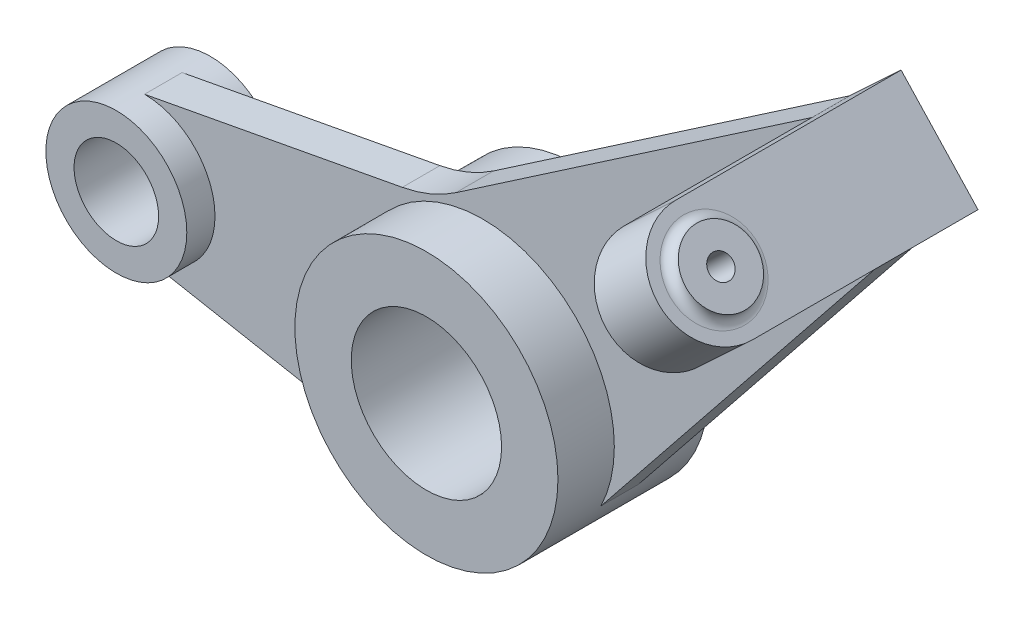
from build123d import *

# Parameters (mm, degrees)
SKETCH1_R           = 28
SKETCH1_R_2         = 16
BOSS_EXTRUDE1_DEPTH = 16
SKETCH2_R           = 15
SKETCH2_R_2         = 9
BOSS_EXTRUDE2_DEPTH = 10
BOSS_EXTRUDE3_DEPTH = 4
BOSS_EXTRUDE4_DEPTH = 4
BOSS_EXTRUDE5_DEPTH = 60
CUT_EXTRUDE1_DEPTH  = 216.77207691
HOLE1_D             = 5
HOLE1_CBORE_D       = 12
HOLE1_CBORE_DEPTH   = 6
BOSS_EXTRUDE6_START = 2
SKETCH9_R           = 7.5
SKETCH9_R_2         = 2.5
BOSS_EXTRUDE6_DEPTH = 2
FILLET1_R           = 30
FILLET2_R           = 2


with BuildPart() as part:
    # Sketch1 → Boss-Extrude1 (new, symmetric)
    with BuildSketch(Plane.XY):
        Circle(SKETCH1_R)
        Circle(SKETCH1_R_2, mode=Mode.SUBTRACT)
    extrude(amount=BOSS_EXTRUDE1_DEPTH, both=True)



with BuildPart() as body_2:
    # Sketch2 → Boss-Extrude2 (new, symmetric)
    with BuildSketch(Plane.XY):
        with Locations((-72, 0)):
            Circle(SKETCH2_R)
        with Locations((-72, 0)):
            Circle(SKETCH2_R_2, mode=Mode.SUBTRACT)
    extrude(amount=BOSS_EXTRUDE2_DEPTH, both=True)


with BuildPart() as part_1:
    add(part.part)

    add(body_2.part)  # Boss-Extrude3 merges body 2
    # Sketch3 → Boss-Extrude3 (add, symmetric)
    with BuildSketch(Plane.XY):
        with BuildLine():
            Line((-72, 15), (-5.155280446, 27.521320527))
            ThreePointArc((-5.155280446, 27.521320527), (-28, 0), (-5.155280446, -27.521320527))
            Line((-5.155280446, -27.521320527), (-72, -15))
            ThreePointArc((-72, -15), (-57, 0), (-72, 15))
        make_face()
    extrude(amount=BOSS_EXTRUDE3_DEPTH, both=True)

    # Sketch4 → Boss-Extrude4 (add, symmetric)
    with BuildSketch(Plane.XY):
        with BuildLine():
            Line((70.070865753, 81.750068946), (86.438826394, 64.197580107))
            Line((86.438826394, 64.197580107), (25.1229929, -12.362654559))
            ThreePointArc((25.1229929, -12.362654559), (22.301575109, 16.930438496), (-5.155280446, 27.521320527))
            Line((-5.155280446, 27.521320527), (-10.933902304, 26.438871876))
            Line((-10.933902304, 26.438871876), (70.070865753, 81.750068946))
        make_face()
    extrude(amount=BOSS_EXTRUDE4_DEPTH, both=True)

    # Sketch5 → Boss-Extrude5 (add)
    with BuildSketch(Plane(origin=(0, 0, -4), x_dir=(-1, 0, 0), z_dir=(0, 0, -1))):
        Polygon((-70.070865753, 81.750068946), (-81.041171277, 91.980044347), (-97.409131918, 74.427555508), (-86.438826394, 64.197580107), align=None)
    extrude(amount=-BOSS_EXTRUDE5_DEPTH)

    # Sketch6 → Cut-Extrude1 (cut, through all)
    with BuildSketch(Plane(origin=(89.225151598, 83.203799928, 0), x_dir=(0, 0, -1), z_dir=(0.7313537016191697, 0.6819983600624995, 0))):
        with BuildLine():
            Line((-56, 12), (-56, 0))
            ThreePointArc((-56, 0), (-52.485281374, 8.485281374), (-44, 12))
            Line((-44, 12), (-56, 12))
        make_face()
        with BuildLine():
            Line((-56, 0), (-56, -12))
            Line((-56, -12), (-44, -12))
            ThreePointArc((-44, -12), (-52.485281374, -8.485281374), (-56, 0))
        make_face()
    extrude(amount=-CUT_EXTRUDE1_DEPTH, mode=Mode.SUBTRACT)

    # Hole1 (through all)
    with Locations(Plane(origin=(78.254846073, 72.973824527, 0), x_dir=(0, 0, 1), z_dir=(-0.7313537016191697, -0.6819983600624995, 0))):
        with Locations((44, 0)):
            CounterBoreHole(HOLE1_D / 2, HOLE1_CBORE_D / 2, HOLE1_CBORE_DEPTH)

    # Sketch9 → Boss-Extrude6 (add)
    with BuildSketch(Plane(origin=(89.225151598, 83.203799928, 0), x_dir=(0, 0, -1), z_dir=(0.7313537016191697, 0.6819983600624995, 0)).offset(BOSS_EXTRUDE6_START)):
        with Locations(Location((-44, 0, 0), (0, 0, 90))):
            Circle(SKETCH9_R)
        with Locations(Location((-44, 0, 0), (0, 0, 270))):
            Circle(SKETCH9_R_2, mode=Mode.SUBTRACT)
    extrude(amount=-BOSS_EXTRUDE6_DEPTH)

    # Fillet1
    fillet1_edges = [part_1.edges().sort_by_distance(p)[0] for p in [
        (-10.933902304, 26.438871876, 0),
    ]]
    fillet(fillet1_edges, radius=FILLET1_R)

    # Fillet2
    fillet2_edges = [part_1.edges().sort_by_distance(p)[0] for p in [
        (94.340139298, 77.718647165, 44),
    ]]
    fillet(fillet2_edges, radius=FILLET2_R - 0.0001)  # a hair under: the kernel refuses the full size


solid = part_1.part
